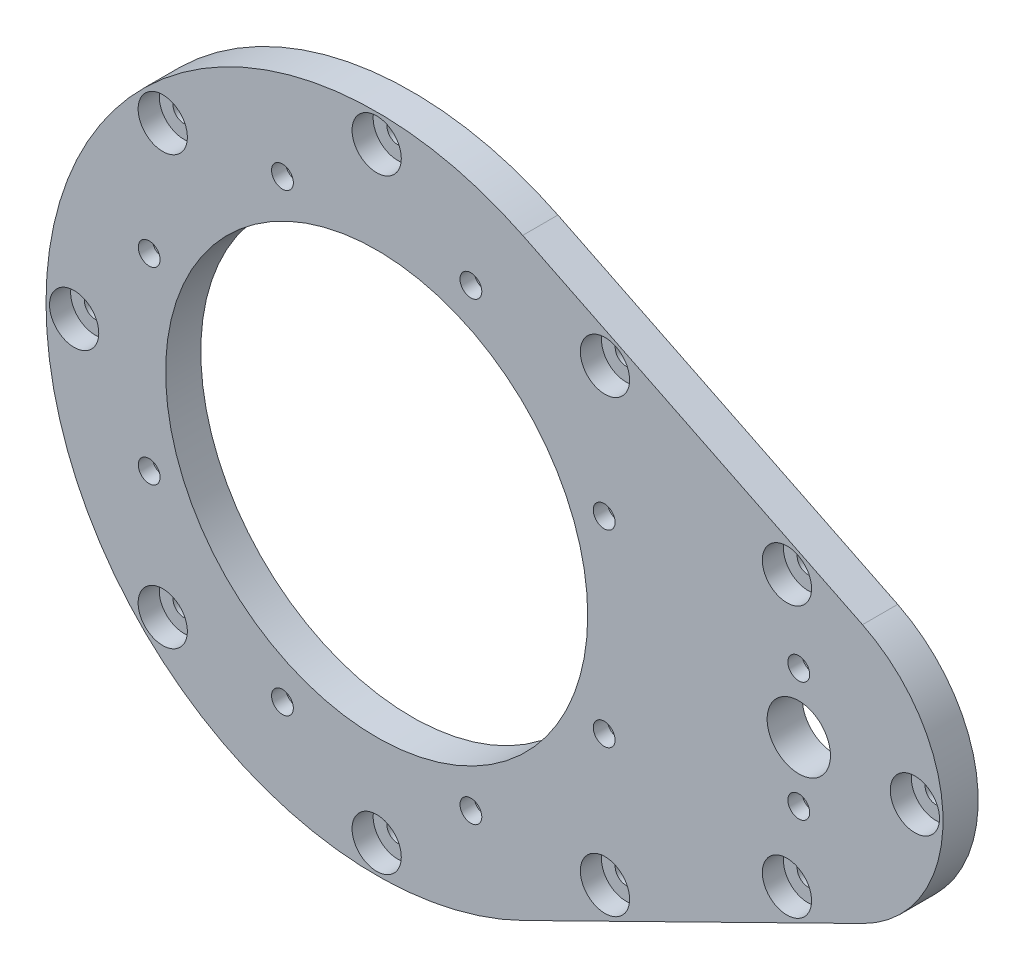
from build123d import *

# Parameters (mm, degrees)
SKETCH1_R           = 1.55
SKETCH1_R_2         = 4.5
SKETCH1_R_3         = 30
BOSS_EXTRUDE2_DEPTH = 5
SKETCH2_R           = 3.5
CUT_EXTRUDE1_DEPTH  = 3
SKETCH3_R           = 3.5
CUT_EXTRUDE2_DEPTH  = 3


with BuildPart() as part:
    # Sketch1 → Boss-Extrude2 (new body)
    with BuildSketch(Plane.XY):
        with BuildLine():
            Line((69.054166667, 18.392174041), (20.758333333, 42.167423412))
            ThreePointArc((20.758333333, 42.167423412), (-47, 0), (20.758333333, -42.167423412))
            Line((20.758333333, -42.167423412), (69.054166667, -18.392174041))
            ThreePointArc((69.054166667, -18.392174041), (80.5, 0), (69.054166667, 18.392174041))
        make_face()
        with Locations((60, 8.5)):
            Circle(SKETCH1_R, mode=Mode.SUBTRACT)
        with Locations((60, -8.5)):
            Circle(SKETCH1_R, mode=Mode.SUBTRACT)
        with Locations((60, 0)):
            Circle(SKETCH1_R_2, mode=Mode.SUBTRACT)
        Circle(SKETCH1_R_3, mode=Mode.SUBTRACT)
        with Locations((0, 43)):
            Circle(SKETCH1_R, mode=Mode.SUBTRACT)
        with Locations((-30.405591591, 30.405591591)):
            Circle(SKETCH1_R, mode=Mode.SUBTRACT)
        with Locations((-43, 0)):
            Circle(SKETCH1_R, mode=Mode.SUBTRACT)
        with Locations((-30.405591591, -30.405591591)):
            Circle(SKETCH1_R, mode=Mode.SUBTRACT)
        with Locations((0, -43)):
            Circle(SKETCH1_R, mode=Mode.SUBTRACT)
        with Locations((32.335783638, 13.393920133)):
            Circle(SKETCH1_R, mode=Mode.SUBTRACT)
        with Locations((32.335783638, -13.393920133)):
            Circle(SKETCH1_R, mode=Mode.SUBTRACT)
        with Locations((13.393920133, -32.335783638)):
            Circle(SKETCH1_R, mode=Mode.SUBTRACT)
        with Locations((-13.393920133, -32.335783638)):
            Circle(SKETCH1_R, mode=Mode.SUBTRACT)
        with Locations((-32.335783638, -13.393920133)):
            Circle(SKETCH1_R, mode=Mode.SUBTRACT)
        with Locations((-32.335783638, 13.393920133)):
            Circle(SKETCH1_R, mode=Mode.SUBTRACT)
        with Locations((-13.393920133, 32.335783638)):
            Circle(SKETCH1_R, mode=Mode.SUBTRACT)
        with Locations((13.393920133, 32.335783638)):
            Circle(SKETCH1_R, mode=Mode.SUBTRACT)
        with Locations((32.44935499, 31.953706526)):
            Circle(SKETCH1_R, mode=Mode.SUBTRACT)
        with Locations((58.315707785, 19.220123822)):
            Circle(SKETCH1_R, mode=Mode.SUBTRACT)
        with Locations((32.44935499, -31.953706526)):
            Circle(SKETCH1_R, mode=Mode.SUBTRACT)
        with Locations((58.315707785, -19.220123822)):
            Circle(SKETCH1_R, mode=Mode.SUBTRACT)
        with Locations((76.5, 0)):
            Circle(SKETCH1_R, mode=Mode.SUBTRACT)
    extrude(amount=BOSS_EXTRUDE2_DEPTH)

    # Sketch2 → Cut-Extrude1 (cut)
    with BuildSketch(Plane(origin=(0, 0, 0), x_dir=(-1, 0, 0), z_dir=(0, 0, -1))):
        with Locations((-60, 8.5)):
            Circle(SKETCH2_R)
        with Locations((-60, -8.5)):
            Circle(SKETCH2_R)
        with Locations((-13.393920133, 32.335783638)):
            Circle(SKETCH2_R)
        with Locations((13.393920133, 32.335783638)):
            Circle(SKETCH2_R)
        with Locations((32.335783638, 13.393920133)):
            Circle(SKETCH2_R)
        with Locations((32.335783638, -13.393920133)):
            Circle(SKETCH2_R)
        with Locations((13.393920133, -32.335783638)):
            Circle(SKETCH2_R)
        with Locations((-13.393920133, -32.335783638)):
            Circle(SKETCH2_R)
        with Locations((-32.335783638, -13.393920133)):
            Circle(SKETCH2_R)
        with Locations((-32.335783638, 13.393920133)):
            Circle(SKETCH2_R)
    extrude(amount=-CUT_EXTRUDE1_DEPTH, mode=Mode.SUBTRACT)

    # Sketch3 → Cut-Extrude2 (cut)
    with BuildSketch(Plane.XY.offset(5)):
        with Locations((0, 43)):
            Circle(SKETCH3_R)
        with Locations((-30.405591591, 30.405591591)):
            Circle(SKETCH3_R)
        with Locations((-43, 0)):
            Circle(SKETCH3_R)
        with Locations((-30.405591591, -30.405591591)):
            Circle(SKETCH3_R)
        with Locations((0, -43)):
            Circle(SKETCH3_R)
        with Locations((32.44935499, 31.953706526)):
            Circle(SKETCH3_R)
        with Locations((58.315707785, 19.220123822)):
            Circle(SKETCH3_R)
        with Locations((32.44935499, -31.953706526)):
            Circle(SKETCH3_R)
        with Locations((58.315707785, -19.220123822)):
            Circle(SKETCH3_R)
        with Locations((76.5, 0)):
            Circle(SKETCH3_R)
    extrude(amount=-CUT_EXTRUDE2_DEPTH, mode=Mode.SUBTRACT)


solid = part.part
